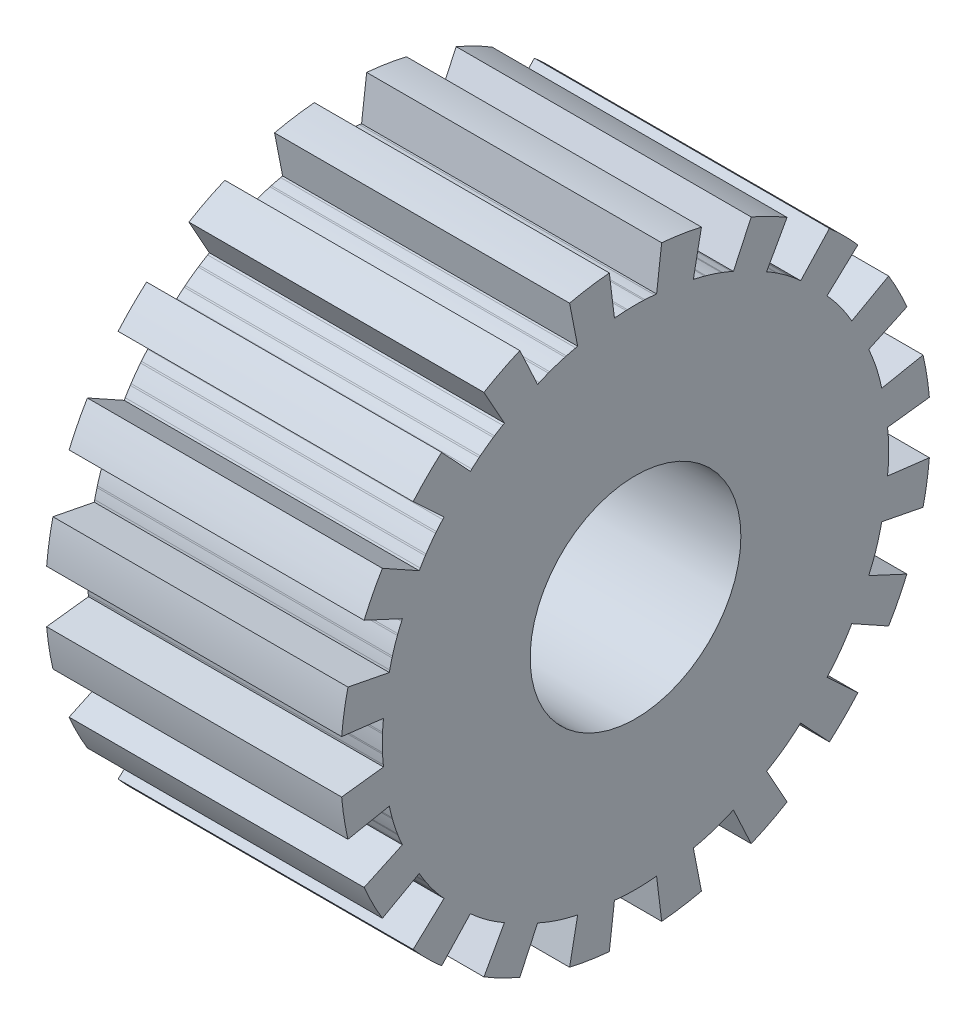
from build123d import *

# Parameters (mm, degrees)
SKETCH1_R                = 70
SKETCH1_R_2              = 25
BOSS_EXTRUDE1_DEPTH      = 35
CUT_EXTRUDE1_DEPTH       = 122.24355653
FILLET2_R                = 40
CIRPATTERN2_COUNT        = 20
FILLET2_OF_CIRPATTERN2_R = 40


with BuildPart() as part:
    # Sketch1 → Boss-Extrude1 (new, symmetric)
    with BuildSketch(Plane(origin=(0, 0, 0), x_dir=(0, 0, -1), z_dir=(1, 0, 0))):
        Circle(SKETCH1_R)
        Circle(SKETCH1_R_2, mode=Mode.SUBTRACT)
    extrude(amount=BOSS_EXTRUDE1_DEPTH, both=True)

    # Sketch2 → Cut-Extrude1 (cut, through all)
    with BuildSketch(Plane(origin=(35, 0, 0), x_dir=(0, 0, -1), z_dir=(1, 0, 0))):
        Polygon((0, 60.123482978), (-3.387218626, 59.961257305), (-5, 59.791303716), (-9.571256192, 97.377400695), (9.571256192, 97.377400695), (5, 59.791303716), (3.387218626, 59.961257305), align=None)
    cut_extrude1 = extrude(amount=-CUT_EXTRUDE1_DEPTH, mode=Mode.SUBTRACT)

    # Fillet2
    # the kernel refuses this fillet: 40 mm, written as the material it takes off along each edge
    with BuildSketch(Plane(origin=(37.857516776, 59.961257305, -3.387218626), x_dir=(0, -0.10479890931300861, -0.9944934331642435), z_dir=(-1, 0, 0)), Plane(origin=(37.857516776, 59.961257305, 3.387218626), x_dir=(0, 0.0478386412435427, -0.9988550767773929), z_dir=(-1, 0, 0))) as fillet2_piece_1:
        with BuildLine():
            CenterArc((FILLET2_R * 0.0285751677569, FILLET2_R), FILLET2_R, 266.726417787, 3.273582213)
            Line((-FILLET2_R * 0.028528540283, FILLET2_R * 0.00163174803678), (0, 0))
            Line((0, 0), (FILLET2_R * 0.0285751677569, 0))
        make_face()
    extrude(amount=75.715033551, mode=Mode.SUBTRACT)
    with BuildSketch(Plane(origin=(39.78934756, 60.123482978, 0), x_dir=(0, -0.04783864124354699, -0.9988550767773928), z_dir=(-1, 0, 0))) as fillet2_piece_2:
        with BuildLine():
            CenterArc((FILLET2_R * 0.047893475596, FILLET2_R), FILLET2_R, 264.51600244, 5.48399756)
            Line((-FILLET2_R * 0.0476742637485, FILLET2_R * 0.00457707119206), (0, 0))
            Line((0, 0), (FILLET2_R * 0.047893475596, 0))
        make_face()
    extrude(amount=79.578695119, mode=Mode.SUBTRACT)

    # CirPattern2: Cut-Extrude1 ×20 about axis
    cirpattern2_axis = Axis((0, 0, 0), (1, 0, 0))
    for i in range(1, CIRPATTERN2_COUNT):
        add(cut_extrude1.rotate(cirpattern2_axis, i * 360 / CIRPATTERN2_COUNT), mode=Mode.SUBTRACT)

    # Fillet2 of CirPattern2
    # the kernel refuses this fillet: 40 mm, written as the material it takes off along each edge
    with BuildSketch(Plane(origin=(37.857516776, 58.073252605, 15.307611165), x_dir=(0, -0.26316594215652367, 0.9647505827356981), z_dir=(-1, 0, 0)), Plane(origin=(37.857516776, 55.979836366, 21.750483858), x_dir=(0, -0.4069850572447982, 0.9134348160539144), z_dir=(-1, 0, 0)), Plane(origin=(37.857516776, 50.500633319, 32.50402532), x_dir=(0, -0.5484100095533818, 0.8362095798432709), z_dir=(-1, 0, 0)), Plane(origin=(37.857516776, 46.518719009, 37.984660185), x_dir=(0, -0.6693326721418366, 0.7429628348736353), z_dir=(-1, 0, 0)), Plane(origin=(37.857516776, 37.984660185, 46.518719009), x_dir=(0, -0.7799718842179362, 0.6258145570610534), z_dir=(-1, 0, 0)), Plane(origin=(37.857516776, 32.50402532, 50.500633319), x_dir=(0, -0.8661613415746809, 0.49976447488947146), z_dir=(-1, 0, 0)), Plane(origin=(37.857516776, 21.750483858, 55.979836366), x_dir=(0, -0.9351846764715747, 0.3541604451272844), z_dir=(-1, 0, 0)), Plane(origin=(37.857516776, 15.307611165, 58.073252605), x_dir=(0, -0.9782041039932707, 0.20764568603927785), z_dir=(-1, 0, 0)), Plane(origin=(37.857516776, 3.387218626, 59.961257305), x_dir=(0, -0.9988550767773927, 0.04783864124354889), z_dir=(-1, 0, 0)), Plane(origin=(37.857516776, -3.387218626, 59.961257305), x_dir=(0, -0.9944934331642435, -0.10479890931300861), z_dir=(-1, 0, 0)), Plane(origin=(37.857516776, -15.307611165, 58.073252605), x_dir=(0, -0.9647505827356967, -0.26316594215652905), z_dir=(-1, 0, 0)), Plane(origin=(37.857516776, -21.750483858, 55.979836366), x_dir=(0, -0.9134348160539114, -0.4069850572448045), z_dir=(-1, 0, 0)), Plane(origin=(37.857516776, -32.50402532, 50.500633319), x_dir=(0, -0.8362095798432709, -0.5484100095533818), z_dir=(-1, 0, 0)), Plane(origin=(37.857516776, -37.984660185, 46.518719009), x_dir=(0, -0.7429628348736353, -0.6693326721418366), z_dir=(-1, 0, 0)), Plane(origin=(37.857516776, -46.518719009, 37.984660185), x_dir=(0, -0.6258145570610495, -0.7799718842179392), z_dir=(-1, 0, 0)), Plane(origin=(37.857516776, -50.500633319, 32.50402532), x_dir=(0, -0.4997644748894654, -0.8661613415746844), z_dir=(-1, 0, 0)), Plane(origin=(37.857516776, -55.979836366, 21.750483858), x_dir=(0, -0.3541604451272909, -0.9351846764715723), z_dir=(-1, 0, 0)), Plane(origin=(37.857516776, -58.073252605, 15.307611165), x_dir=(0, -0.2076456860392779, -0.9782041039932708), z_dir=(-1, 0, 0)), Plane(origin=(37.857516776, -59.961257305, 3.387218626), x_dir=(0, -0.04783864124354889, -0.9988550767773927), z_dir=(-1, 0, 0)), Plane(origin=(37.857516776, -59.961257305, -3.387218626), x_dir=(0, 0.10479890931300874, -0.9944934331642435), z_dir=(-1, 0, 0)), Plane(origin=(37.857516776, -58.073252605, -15.307611165), x_dir=(0, 0.26316594215652905, -0.9647505827356967), z_dir=(-1, 0, 0)), Plane(origin=(37.857516776, -55.979836366, -21.750483858), x_dir=(0, 0.4069850572447982, -0.9134348160539144), z_dir=(-1, 0, 0)), Plane(origin=(37.857516776, -50.500633319, -32.50402532), x_dir=(0, 0.5484100095533889, -0.8362095798432662), z_dir=(-1, 0, 0)), Plane(origin=(37.857516776, -46.518719009, -37.984660185), x_dir=(0, 0.6693326721418366, -0.7429628348736353), z_dir=(-1, 0, 0)), Plane(origin=(37.857516776, -37.984660185, -46.518719009), x_dir=(0, 0.7799718842179416, -0.6258145570610465), z_dir=(-1, 0, 0)), Plane(origin=(37.857516776, -32.50402532, -50.500633319), x_dir=(0, 0.8661613415746836, -0.4997644748894668), z_dir=(-1, 0, 0)), Plane(origin=(37.857516776, -21.750483858, -55.979836366), x_dir=(0, 0.9351846764715747, -0.3541604451272844), z_dir=(-1, 0, 0)), Plane(origin=(37.857516776, -15.307611165, -58.073252605), x_dir=(0, 0.9782041039932707, -0.20764568603927785), z_dir=(-1, 0, 0)), Plane(origin=(37.857516776, -3.387218626, -59.961257305), x_dir=(0, 0.9988550767773927, -0.04783864124354889), z_dir=(-1, 0, 0)), Plane(origin=(37.857516776, 3.387218626, -59.961257305), x_dir=(0, 0.9944934331642435, 0.10479890931300861), z_dir=(-1, 0, 0)), Plane(origin=(37.857516776, 15.307611165, -58.073252605), x_dir=(0, 0.9647505827356966, 0.26316594215652944), z_dir=(-1, 0, 0)), Plane(origin=(37.857516776, 21.750483858, -55.979836366), x_dir=(0, 0.9134348160539144, 0.4069850572447982), z_dir=(-1, 0, 0)), Plane(origin=(37.857516776, 32.50402532, -50.500633319), x_dir=(0, 0.8362095798432709, 0.5484100095533818), z_dir=(-1, 0, 0)), Plane(origin=(37.857516776, 37.984660185, -46.518719009), x_dir=(0, 0.7429628348736385, 0.6693326721418332), z_dir=(-1, 0, 0)), Plane(origin=(37.857516776, 46.518719009, -37.984660185), x_dir=(0, 0.6258145570610465, 0.7799718842179416), z_dir=(-1, 0, 0)), Plane(origin=(37.857516776, 50.500633319, -32.50402532), x_dir=(0, 0.4997644748894654, 0.8661613415746844), z_dir=(-1, 0, 0)), Plane(origin=(37.857516776, 55.979836366, -21.750483858), x_dir=(0, 0.35416044512728334, 0.9351846764715751), z_dir=(-1, 0, 0)), Plane(origin=(37.857516776, 58.073252605, -15.307611165), x_dir=(0, 0.20764568603927192, 0.978204103993272), z_dir=(-1, 0, 0))) as fillet2_of_cirpattern2_piece_1:
        with BuildLine():
            CenterArc((FILLET2_OF_CIRPATTERN2_R * 0.0285751677569, -FILLET2_OF_CIRPATTERN2_R), FILLET2_OF_CIRPATTERN2_R, 90, 3.273582213)
            Line((-FILLET2_OF_CIRPATTERN2_R * 0.028528540283, -FILLET2_OF_CIRPATTERN2_R * 0.00163174803678), (0, 0))
            Line((0, 0), (FILLET2_OF_CIRPATTERN2_R * 0.0285751677569, 0))
        make_face()
    extrude(amount=75.715033551, mode=Mode.SUBTRACT)
    with BuildSketch(Plane(origin=(39.78934756, 57.180830268, 18.579178001), x_dir=(0, -0.35416044512729267, 0.9351846764715714), z_dir=(-1, 0, 0)), Plane(origin=(39.78934756, 48.64091949, 35.339696611), x_dir=(0, -0.6258145570610536, 0.779971884217936), z_dir=(-1, 0, 0)), Plane(origin=(39.78934756, 35.339696611, 48.64091949), x_dir=(0, -0.8362095798432713, 0.5484100095533812), z_dir=(-1, 0, 0)), Plane(origin=(39.78934756, 18.579178001, 57.180830268), x_dir=(0, -0.9647505827356971, 0.26316594215652744), z_dir=(-1, 0, 0)), Plane(origin=(39.78934756, 0, 60.123482978), x_dir=(0, -0.9988550767773928, -0.04783864124354698), z_dir=(-1, 0, 0)), Plane(origin=(39.78934756, -18.579178001, 57.180830268), x_dir=(0, -0.9351846764715732, -0.3541604451272882), z_dir=(-1, 0, 0)), Plane(origin=(39.78934756, -35.339696611, 48.64091949), x_dir=(0, -0.779971884217936, -0.6258145570610536), z_dir=(-1, 0, 0)), Plane(origin=(39.78934756, -48.64091949, 35.339696611), x_dir=(0, -0.5484100095533752, -0.8362095798432753), z_dir=(-1, 0, 0)), Plane(origin=(39.78934756, -57.180830268, 18.579178001), x_dir=(0, -0.2631659421565196, -0.9647505827356992), z_dir=(-1, 0, 0)), Plane(origin=(39.78934756, -60.123482978, 0), x_dir=(0, 0.047838641243546975, -0.9988550767773928), z_dir=(-1, 0, 0)), Plane(origin=(39.78934756, -57.180830268, -18.579178001), x_dir=(0, 0.3541604451272965, -0.93518467647157), z_dir=(-1, 0, 0)), Plane(origin=(39.78934756, -48.64091949, -35.339696611), x_dir=(0, 0.6258145570610536, -0.779971884217936), z_dir=(-1, 0, 0)), Plane(origin=(39.78934756, -35.339696611, -48.64091949), x_dir=(0, 0.8362095798432713, -0.5484100095533812), z_dir=(-1, 0, 0)), Plane(origin=(39.78934756, -18.579178001, -57.180830268), x_dir=(0, 0.9647505827356982, -0.26316594215652356), z_dir=(-1, 0, 0)), Plane(origin=(39.78934756, 0, -60.123482978), x_dir=(0, 0.9988550767773928, 0.047838641243546975), z_dir=(-1, 0, 0)), Plane(origin=(39.78934756, 18.579178001, -57.180830268), x_dir=(0, 0.9351846764715714, 0.35416044512729267), z_dir=(-1, 0, 0)), Plane(origin=(39.78934756, 35.339696611, -48.64091949), x_dir=(0, 0.779971884217936, 0.6258145570610536), z_dir=(-1, 0, 0)), Plane(origin=(39.78934756, 48.64091949, -35.339696611), x_dir=(0, 0.5484100095533795, 0.8362095798432724), z_dir=(-1, 0, 0)), Plane(origin=(39.78934756, 57.180830268, -18.579178001), x_dir=(0, 0.263165942156524, 0.9647505827356981), z_dir=(-1, 0, 0))) as fillet2_of_cirpattern2_piece_2:
        with BuildLine():
            CenterArc((FILLET2_OF_CIRPATTERN2_R * 0.047893475596, -FILLET2_OF_CIRPATTERN2_R), FILLET2_OF_CIRPATTERN2_R, 90, 5.48399756)
            Line((-FILLET2_OF_CIRPATTERN2_R * 0.0476742637485, -FILLET2_OF_CIRPATTERN2_R * 0.00457707119206), (0, 0))
            Line((0, 0), (FILLET2_OF_CIRPATTERN2_R * 0.047893475596, 0))
        make_face()
    extrude(amount=79.578695119, mode=Mode.SUBTRACT)


solid = part.part
